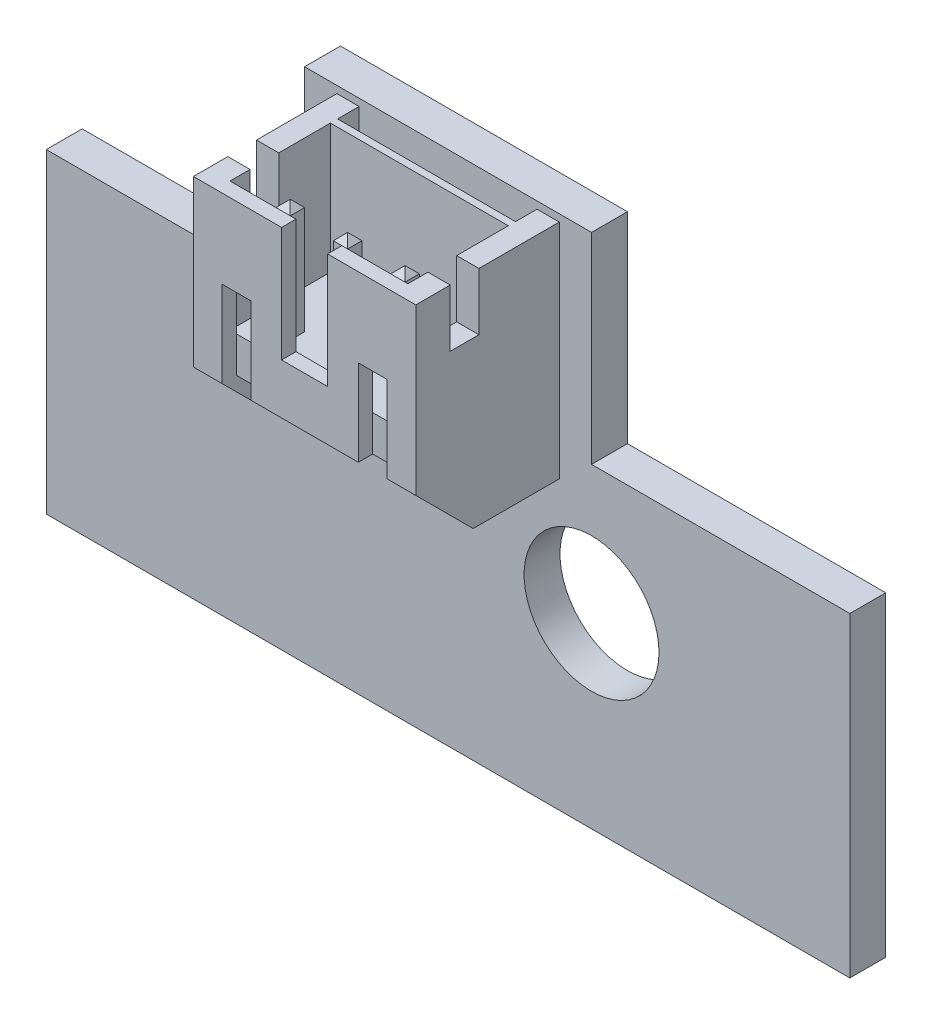
from build123d import *

# Parameters (mm, degrees)
CROQUIS1_W          = 10
CROQUIS1_H          = 7
EXTRUIR1_DEPTH      = 1.25
CROQUIS2_W          = 7.75
CROQUIS2_H          = 7.75
EXTRUIR2_DEPTH      = 5
CROQUIS3_W          = 6.199548142
CROQUIS3_H          = 3.5
EXTRUIR3_DEPTH      = 4.5
CROQUIS4_W          = 5.75
CROQUIS4_H          = 2
EXTRUIR4_DEPTH      = 5
CHAFL_N1_SIZE       = 2
CROQUIS5_W          = 6.199548142
CROQUIS5_H          = 0.75
EXTRUIR5_DEPTH      = 5.75
CROQUIS6_W          = 1
CROQUIS6_H          = 3
CROQUIS6_W_2        = 0.8
CROQUIS6_H_2        = 4
EXTRUIR6_DEPTH      = 0.5
EXTRUIR7_REACH      = 24.69
CROQUIS7_W          = 1
CROQUIS7_H          = 2
EXTRUIR8_DEPTH      = 4
EXTRUIR8_DEPTH_BACK = 2.5
CROQUIS8_W          = 0.5
CROQUIS8_H          = 0.5
CHAFL_N2_SIZE       = 0.25
CROQUIS9_W          = 0.5
CROQUIS9_H          = 0.5
EXTRUIR9_DEPTH      = 5.75
CHAFL_N3_SIZE       = 0.25


with BuildPart() as part:
    # Croquis1 → Extruir1 (new body)
    with BuildSketch(Plane.XY):
        with BuildLine():
            Line((-14, -5.5), (14, -5.5))
            Line((14, -5.5), (14, 5.5))
            Line((14, 5.5), (5, 5.5))
            Line((5, 5.5), (5, 3.35))
            ThreePointArc((5, 3.35), (6.661700936, 2.661700936), (7.35, 1))
            ThreePointArc((7.35, 1), (6.661700936, -0.661700936), (5, -1.35))
            Line((5, -1.35), (5, -1.5))
            Line((5, -1.5), (-5, -1.5))
            Line((-5, -1.5), (-5, 5.5))
            Line((-5, 5.5), (-14, 5.5))
            Line((-14, 5.5), (-14, -5.5))
        make_face()
        with Locations((0, 9)):
            Rectangle(CROQUIS1_W, CROQUIS1_H)
        with BuildLine():
            Line((5, 3.35), (5, 5.5))
            Line((5, 5.5), (-5, 5.5))
            Line((-5, 5.5), (-5, -1.5))
            Line((-5, -1.5), (5, -1.5))
            Line((5, -1.5), (5, -1.35))
            ThreePointArc((5, -1.35), (2.65, 1), (5, 3.35))
        make_face()
    extrude(amount=EXTRUIR1_DEPTH)

    # Croquis2 → Extruir2 (add)
    with BuildSketch(Plane.XY.offset(1.25)):
        with Locations((0, 8.375)):
            Rectangle(CROQUIS2_W, CROQUIS2_H)
    extrude(amount=EXTRUIR2_DEPTH)

    # Croquis3 → Extruir3 (cut)
    with BuildSketch(Plane(origin=(0, 12.25, 0), x_dir=(-1, 0, 0), z_dir=(0, 1, 0))):
        with Locations((0, 4)):
            Rectangle(CROQUIS3_W, CROQUIS3_H)
    extrude(amount=-EXTRUIR3_DEPTH, mode=Mode.SUBTRACT)

    # Croquis4 → Extruir4 (cut)
    with BuildSketch(Plane.XY.offset(6.25)):
        with Locations((0, 5.5)):
            Rectangle(CROQUIS4_W, CROQUIS4_H)
    extrude(amount=-EXTRUIR4_DEPTH, mode=Mode.SUBTRACT)

    # Chaflán1
    chafl_n1_edges = [part.edges().sort_by_distance(p)[0] for p in [
        (3.375, 4.5, 6.25),
        (-3.375, 4.5, 6.25),
    ]]
    chamfer(chafl_n1_edges, length=CHAFL_N1_SIZE)

    # Croquis5 → Extruir5 (cut)
    with BuildSketch(Plane(origin=(0, 12.25, 0), x_dir=(-1, 0, 0), z_dir=(0, 1, 0))):
        with Locations((0, 1.625)):
            Rectangle(CROQUIS5_W, CROQUIS5_H)
    extrude(amount=-EXTRUIR5_DEPTH, mode=Mode.SUBTRACT)

    # Croquis6 → Extruir6 (cut)
    with BuildSketch(Plane.XY.offset(6.25)):
        with Locations((-2.375, 8)):
            Rectangle(CROQUIS6_W, CROQUIS6_H)
        with Locations((0.4, 10.25)):
            Rectangle(CROQUIS6_W_2, CROQUIS6_H_2)
        with Locations((-0.4, 10.25)):
            Rectangle(CROQUIS6_W_2, CROQUIS6_H_2)
        with Locations((2.375, 8)):
            Rectangle(CROQUIS6_W, CROQUIS6_H)
    extrude(amount=-EXTRUIR6_DEPTH, mode=Mode.SUBTRACT)

    # Extruir7: up to this face of the body (flat: up to its plane)
    extruir7_end = Plane(part.part.faces().sort_by_distance((-3.875, 8.549603175, 3.650226757))[0])
    # Croquis7 → Extruir7 (cut, up to the picked face)
    with BuildSketch(Plane(origin=(3.875, 0, 0), x_dir=(0, 0, -1), z_dir=(1, 0, 0)), mode=Mode.PRIVATE) as extruir7_sk1:
        with Locations((-4.55, 11.25)):
            Rectangle(CROQUIS7_W, CROQUIS7_H)
    extruir7_tool1 = split(extrude(extruir7_sk1.sketch, amount=-EXTRUIR7_REACH, mode=Mode.PRIVATE), bisect_by=extruir7_end, keep=Keep.BOTH, mode=Mode.PRIVATE)
    add(extruir7_tool1.solids().sort_by(Axis((3.875, 11.25, 4.55), (-1, 0, 0)))[0], mode=Mode.SUBTRACT)

    # Croquis8 → Extruir8 (add, two sides: drawn at the far end of the back side and taken through both)
    with BuildSketch(Plane(origin=(0, 7.75, 0), x_dir=(-1, 0, 0), z_dir=(0, 1, 0)).offset(-EXTRUIR8_DEPTH_BACK)):
        with Locations((0, 4.75)):
            Rectangle(CROQUIS8_W, CROQUIS8_H)
        with Locations((2, 4.75)):
            Rectangle(CROQUIS8_W, CROQUIS8_H)
        with Locations((-2, 4.75)):
            Rectangle(CROQUIS8_W, CROQUIS8_H)
    extrude(amount=EXTRUIR8_DEPTH + EXTRUIR8_DEPTH_BACK)

    # Chaflán2
    chafl_n2_edges = [part.edges().sort_by_distance(p)[0] for p in [
        (0.25, 11.75, 4.75),
        (0, 11.75, 4.5),
        (-0.25, 11.75, 4.75),
        (0, 11.75, 5),
        (-1.75, 11.75, 4.75),
        (-2, 11.75, 4.5),
        (-2.25, 11.75, 4.75),
        (-2, 11.75, 5),
        (1.75, 11.75, 4.75),
        (2, 11.75, 5),
        (2.25, 11.75, 4.75),
        (2, 11.75, 4.5),
    ]]
    chamfer(chafl_n2_edges, length=CHAFL_N2_SIZE - 0.0001)  # a hair under: the kernel refuses the full size

    # Croquis9 → Extruir9 (add)
    with BuildSketch(Plane.XY.offset(5)):
        with Locations((-2, 5.5)):
            Rectangle(CROQUIS9_W, CROQUIS9_H)
        with Locations((0, 5.5)):
            Rectangle(CROQUIS9_W, CROQUIS9_H)
        with Locations((2, 5.5)):
            Rectangle(CROQUIS9_W, CROQUIS9_H)
    extrude(amount=-EXTRUIR9_DEPTH)

    # Chaflán3
    chafl_n3_edges = [part.edges().sort_by_distance(p)[0] for p in [
        (-2, 5.25, -0.75),
        (-2, 5.75, -0.75),
        (-1.75, 5.5, -0.75),
        (-2.25, 5.5, -0.75),
        (0, 5.75, -0.75),
        (0, 5.25, -0.75),
        (-0.25, 5.5, -0.75),
        (0.25, 5.5, -0.75),
        (2, 5.75, -0.75),
        (2, 5.25, -0.75),
        (1.75, 5.5, -0.75),
        (2.25, 5.5, -0.75),
    ]]
    chamfer(chafl_n3_edges, length=CHAFL_N3_SIZE - 0.0001)  # a hair under: the kernel refuses the full size


solid = part.part
